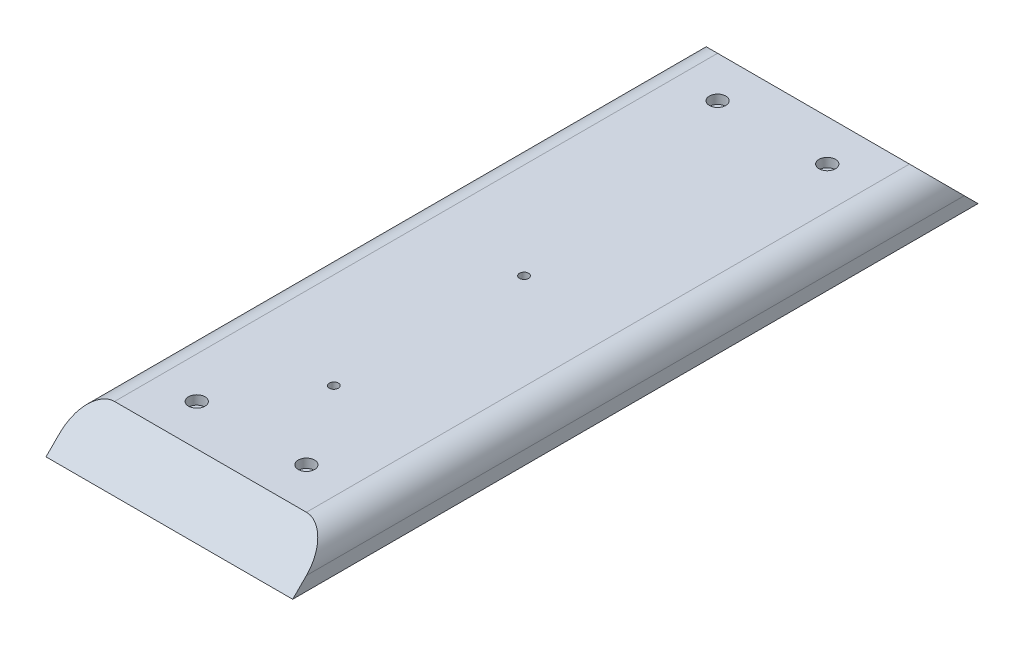
from build123d import *

# Parameters (mm, degrees)
SKETCH1_W           = 90
SKETCH1_H           = 250
BOSS_EXTRUDE1_DEPTH = 15
CHAMFER1_SIZE       = 15
FILLET1_R           = 10
SKETCH2_R           = 1.65
CUT_EXTRUDE1_DEPTH  = 267.129667643
SKETCH3_R           = 3
CUT_EXTRUDE2_DEPTH  = 3.3
SKETCH4_R           = 1.65
CUT_EXTRUDE3_DEPTH  = 267.129667643
CUT_EXTRUDE5_DEPTH  = 10


with BuildPart() as part:
    # Sketch1 → Boss-Extrude1 (new body)
    with BuildSketch(Plane(origin=(0, 0, 0), x_dir=(1, 0, 0), z_dir=(0, 1, 0))):
        with Locations((45, 125)):
            Rectangle(SKETCH1_W, SKETCH1_H)
    extrude(amount=BOSS_EXTRUDE1_DEPTH)

    # Chamfer1
    chamfer1_edges = [part.edges().sort_by_distance(p)[0] for p in [
        (45, 15, 0),
        (45, 15, -250),
    ]]
    chamfer(chamfer1_edges, length=CHAMFER1_SIZE - 0.0001)  # a hair under: the kernel refuses the full size

    # Fillet1
    fillet1_edges = [part.edges().sort_by_distance(p)[0] for p in [
        (0, 15, -125),
        (90, 15, -125),
    ]]
    fillet(fillet1_edges, radius=FILLET1_R)

    # Sketch2 → Cut-Extrude1 (cut, through all)
    with BuildSketch(Plane(origin=(0, 15, 0), x_dir=(1, 0, 0), z_dir=(0, 1, 0))):
        with Locations(Location((25, 30, 0), (0, 0, 270))):
            Circle(SKETCH2_R)
        with Locations(Location((65, 30, 0), (0, 0, 270))):
            Circle(SKETCH2_R)
        with Locations(Location((65, 220, 0), (0, 0, 90))):
            Circle(SKETCH2_R)
        with Locations(Location((25, 220, 0), (0, 0, 90))):
            Circle(SKETCH2_R)
    extrude(amount=-CUT_EXTRUDE1_DEPTH, mode=Mode.SUBTRACT)

    # Sketch3 → Cut-Extrude2 (cut)
    with BuildSketch(Plane(origin=(0, 15, 0), x_dir=(1, 0, 0), z_dir=(0, 1, 0))):
        with Locations(Location((25, 30, 0), (0, 0, 270))):
            Circle(SKETCH3_R)
        with Locations(Location((65, 30, 0), (0, 0, 270))):
            Circle(SKETCH3_R)
        with Locations(Location((65, 220, 0), (0, 0, 90))):
            Circle(SKETCH3_R)
        with Locations(Location((25, 220, 0), (0, 0, 90))):
            Circle(SKETCH3_R)
    extrude(amount=-CUT_EXTRUDE2_DEPTH, mode=Mode.SUBTRACT)

    # Sketch4 → Cut-Extrude3 (cut, through all)
    with BuildSketch(Plane(origin=(0, 15, 0), x_dir=(1, 0, 0), z_dir=(0, 1, 0))):
        with Locations(Location((45, 60, 0), (0, 0, 270))):
            Circle(SKETCH4_R)
        with Locations(Location((45, 129.4, 0), (0, 0, 270))):
            Circle(SKETCH4_R)
    extrude(amount=-CUT_EXTRUDE3_DEPTH, mode=Mode.SUBTRACT)

    # Sketch5 → Cut-Extrude5 (cut)
    with BuildSketch(Plane.XZ):
        Polygon((48.233161507, -60), (46.616580754, -57.2), (43.383419246, -57.2), (41.766838493, -60), (43.383419246, -62.8), (46.616580754, -62.8), align=None)
        Polygon((48.233161507, -129.4), (46.616580754, -126.6), (43.383419246, -126.6), (41.766838493, -129.4), (43.383419246, -132.2), (46.616580754, -132.2), align=None)
    extrude(amount=-CUT_EXTRUDE5_DEPTH, mode=Mode.SUBTRACT)


solid = part.part
